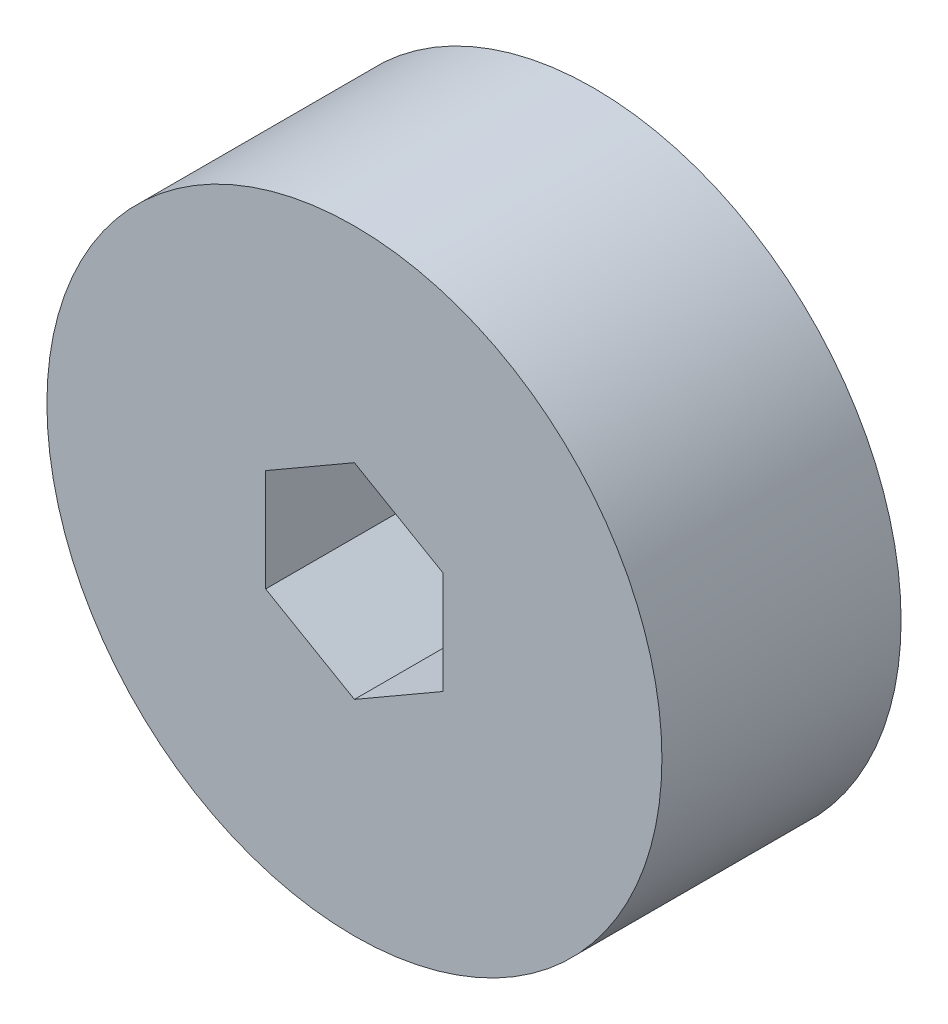
from build123d import *

# Parameters (mm, degrees)
SKETCH1_R           = 9
BOSS_EXTRUDE1_DEPTH = 7


with BuildPart() as part:
    # Sketch1 → Boss-Extrude1 (new body)
    with BuildSketch(Plane.XY):
        Circle(SKETCH1_R)
        Polygon((0, 3), (2.598076211, 1.5), (2.598076211, -1.5), (0, -3), (-2.598076211, -1.5), (-2.598076211, 1.5), align=None, mode=Mode.SUBTRACT)
    extrude(amount=BOSS_EXTRUDE1_DEPTH)


solid = part.part
